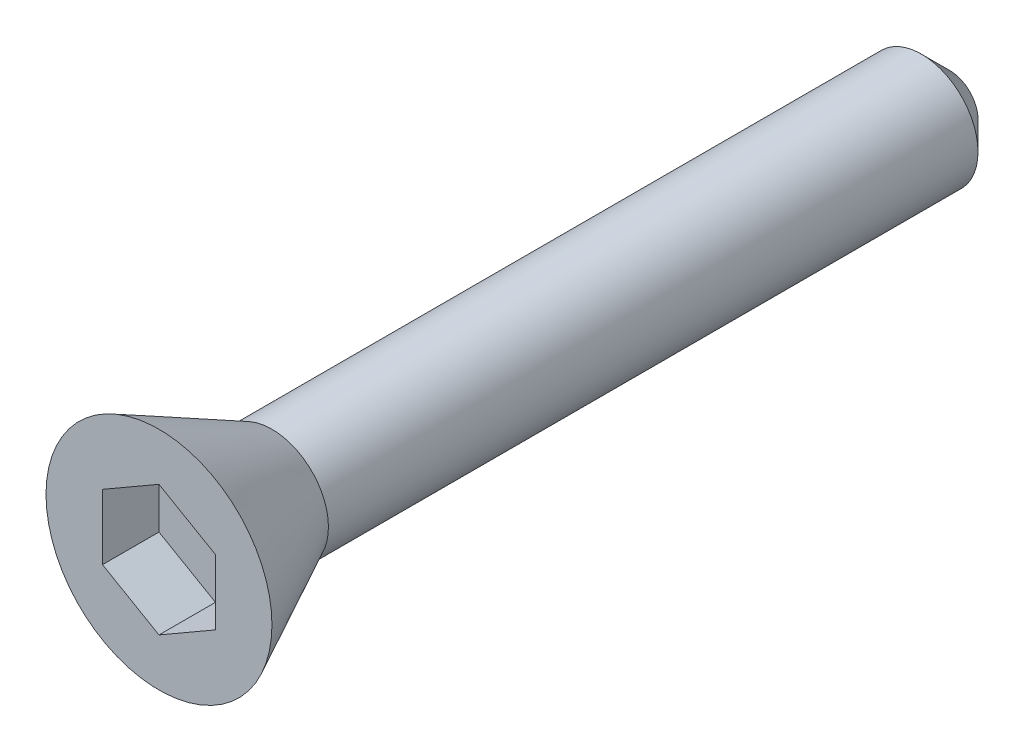
from build123d import *

# Parameters (mm, degrees)
FOOTPRINT_DEPTH = 1
CHAMFER1_SIZE   = 0.5


with BuildPart() as part:
    # Sketch1 → Body (revolve)
    with BuildSketch(Plane(origin=(0, 0, 0), x_dir=(0, 0, -1), z_dir=(1, 0, 0))):
        Polygon((0, 0), (0, 2), (2, 1), (14, 1), (14, 0), align=None)
    revolve(axis=Axis((0, 0, 58.51474448), (0, 0, -1)))

    # Sketch2 → Footprint (cut)
    with BuildSketch(Plane.XY):
        Polygon((0, 1.154700538), (-1, 0.577350269), (-1, -0.577350269), (0, -1.154700538), (1, -0.577350269), (1, 0.577350269), align=None)
    extrude(amount=-FOOTPRINT_DEPTH, mode=Mode.SUBTRACT)

    # Chamfer1
    chamfer1_edges = [part.edges().sort_by_distance(p)[0] for p in [
        (0, -1, -14),
    ]]
    chamfer(chamfer1_edges, length=CHAMFER1_SIZE)


solid = part.part
